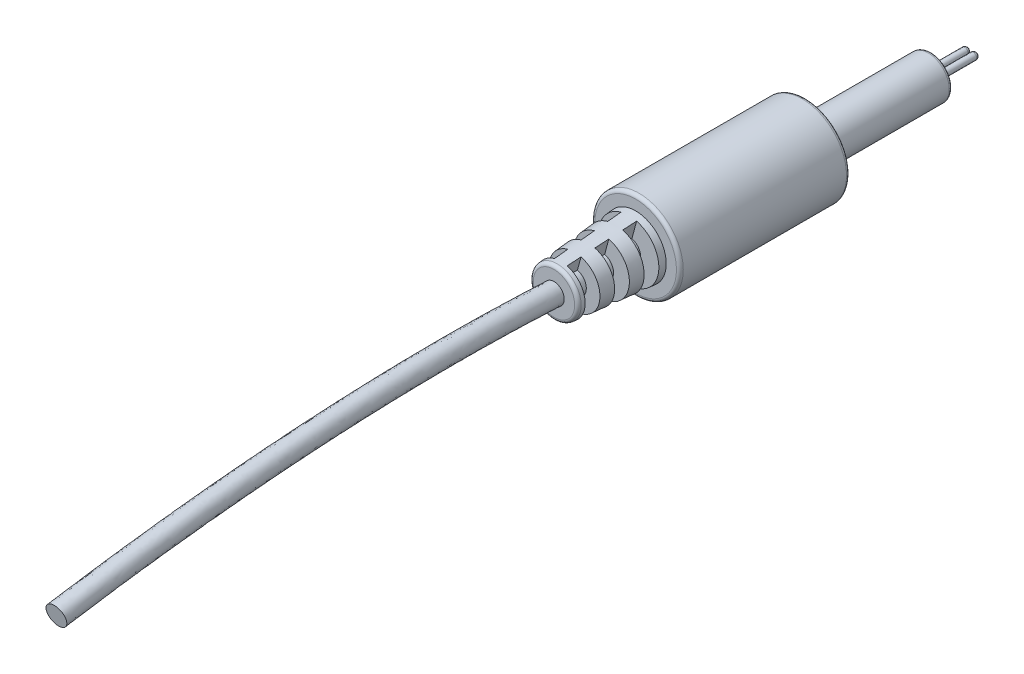
from build123d import *

# Parameters (mm, degrees)
SKETCH3_R            = 0.5
BOSS_EXTRUDE1_DEPTH  = 6
FILLET1_R            = 0.5
SKETCH4_R            = 1.5
CUT_REVOLVE1_START   = -11
CUT_REVOLVE1_DEPTH   = 2
CUT_REVOLVE1_START_2 = -7
CUT_REVOLVE1_2_DEPTH = 2
CUT_REVOLVE1_START_3 = -3
CUT_REVOLVE1_3_DEPTH = 2


# Read off the part's stored shape, not the designer's step: Cut-Revolve1
with BuildPart() as part:
    # Sketch2 → Revolve1 (revolve)
    with BuildSketch(Plane(origin=(0, 0, 0), x_dir=(1, 0, 0), z_dir=(0, 1, 0))):
        Polygon((0, 0), (3.5, 0), (4.5, 12), (6.5, 12), (6.5, 37), (3.1, 37), (3.1, 55.5), (0, 55.5), align=None)
    revolve(axis=Axis((0, 0, 0), (0, 0, -1)))

    # Sketch3 → Boss-Extrude1 (add)
    with BuildSketch(Plane(origin=(0, 0, -55.5), x_dir=(-1, 0, 0), z_dir=(0, 0, -1))):
        with Locations((0.625, 0)):
            Circle(SKETCH3_R)
        with Locations((-0.625, 0)):
            Circle(SKETCH3_R)
    extrude(amount=BOSS_EXTRUDE1_DEPTH)

    # Fillet1
    fillet1_edges = [part.edges().sort_by_distance(p)[0] for p in [
        (-0.125, 0, -61.5),
        (1.125, 0, -61.5),
        (-3.1, 0, -55.5),
        (-6.5, 0, -37),
        (-6.5, 0, -12),
        (-3.5, 0, 0),
    ]]
    fillet(fillet1_edges, radius=FILLET1_R)

    # Sweep1: sweep along a path in Sketch5
    with BuildLine() as sweep1_path:  # in the path sketch's own coordinates; laid on its plane below (add() does not lay a ready-made edge on the line's plane)
        add(Edge.make_bspline(
            [(0, 0), (-24.461892785, 1.312502306), (-48.988806649, -0.632697141), (-73.147794593, -4.461553589)],
            knots=[0, 0, 0, 0, 1, 1, 1, 1], degree=3))
    # Sketch4 → Sweep1 (sweep)
    with BuildSketch(Plane.XY):
        Circle(SKETCH4_R)
    sweep(path=Plane(origin=(0, 0, 0), x_dir=(0, 0, -1), z_dir=(1, 0, 0)) * sweep1_path.line)

    # Cut-Revolve1 outline → Cut-Revolve1 (cut)
    with BuildSketch(Plane.XY.offset(CUT_REVOLVE1_START)):
        with BuildLine():
            ThreePointArc((0.452933329, 1.690370196), (1.75, 0), (0.452933329, -1.690370196))
            Line((0.452933329, -1.690370196), (0.970571419, -3.622221849))
            Line((0.970571419, -3.622221849), (1.056844434, -3.944197124))
            Line((1.056844434, -3.944197124), (1.143117449, -4.266172399))
            Line((1.143117449, -4.266172399), (1.607695154, -6))
            Line((1.607695154, -6), (6, -6))
            Line((6, -6), (6, 6))
            Line((6, 6), (1.607695154, 6))
            Line((1.607695154, 6), (1.143117449, 4.266172399))
            Line((1.143117449, 4.266172399), (1.056844434, 3.944197124))
            Line((1.056844434, 3.944197124), (0.970571419, 3.622221849))
            Line((0.970571419, 3.622221849), (0.452933329, 1.690370196))
        make_face()
    cut_revolve1 = extrude(amount=CUT_REVOLVE1_DEPTH, mode=Mode.SUBTRACT)

    # Cut-Revolve1 2 outline → Cut-Revolve1 2 (cut)
    with BuildSketch(Plane.XY.offset(CUT_REVOLVE1_START_2)):
        with BuildLine():
            ThreePointArc((0.452933329, 1.690370196), (1.75, 0), (0.452933329, -1.690370196))
            Line((0.452933329, -1.690370196), (0.970571419, -3.622221849))
            Line((0.970571419, -3.622221849), (1.056844434, -3.944197124))
            Line((1.056844434, -3.944197124), (1.143117449, -4.266172399))
            Line((1.143117449, -4.266172399), (1.607695154, -6))
            Line((1.607695154, -6), (6, -6))
            Line((6, -6), (6, 6))
            Line((6, 6), (1.607695154, 6))
            Line((1.607695154, 6), (1.143117449, 4.266172399))
            Line((1.143117449, 4.266172399), (1.056844434, 3.944197124))
            Line((1.056844434, 3.944197124), (0.970571419, 3.622221849))
            Line((0.970571419, 3.622221849), (0.452933329, 1.690370196))
        make_face()
    cut_revolve1_2 = extrude(amount=CUT_REVOLVE1_2_DEPTH, mode=Mode.SUBTRACT)

    # Cut-Revolve1 3 outline → Cut-Revolve1 3 (cut)
    with BuildSketch(Plane.XY.offset(CUT_REVOLVE1_START_3)):
        with BuildLine():
            ThreePointArc((0.452933329, 1.690370196), (1.75, 0), (0.452933329, -1.690370196))
            Line((0.452933329, -1.690370196), (0.970571419, -3.622221849))
            Line((0.970571419, -3.622221849), (1.056844434, -3.944197124))
            Line((1.056844434, -3.944197124), (1.143117449, -4.266172399))
            Line((1.143117449, -4.266172399), (1.607695154, -6))
            Line((1.607695154, -6), (6, -6))
            Line((6, -6), (6, 6))
            Line((6, 6), (1.607695154, 6))
            Line((1.607695154, 6), (1.143117449, 4.266172399))
            Line((1.143117449, 4.266172399), (1.056844434, 3.944197124))
            Line((1.056844434, 3.944197124), (0.970571419, 3.622221849))
            Line((0.970571419, 3.622221849), (0.452933329, 1.690370196))
        make_face()
    cut_revolve1_3 = extrude(amount=CUT_REVOLVE1_3_DEPTH, mode=Mode.SUBTRACT)

    # Mirror1: Cut-Revolve1, Cut-Revolve1 2, Cut-Revolve1 3 across plane
    add(cut_revolve1.mirror(Plane(origin=(0, 0, 0), x_dir=(0, 0, 1), z_dir=(1, 0, 0))), mode=Mode.SUBTRACT)
    add(cut_revolve1_2.mirror(Plane(origin=(0, 0, 0), x_dir=(0, 0, 1), z_dir=(1, 0, 0))), mode=Mode.SUBTRACT)
    add(cut_revolve1_3.mirror(Plane(origin=(0, 0, 0), x_dir=(0, 0, 1), z_dir=(1, 0, 0))), mode=Mode.SUBTRACT)


solid = part.part
